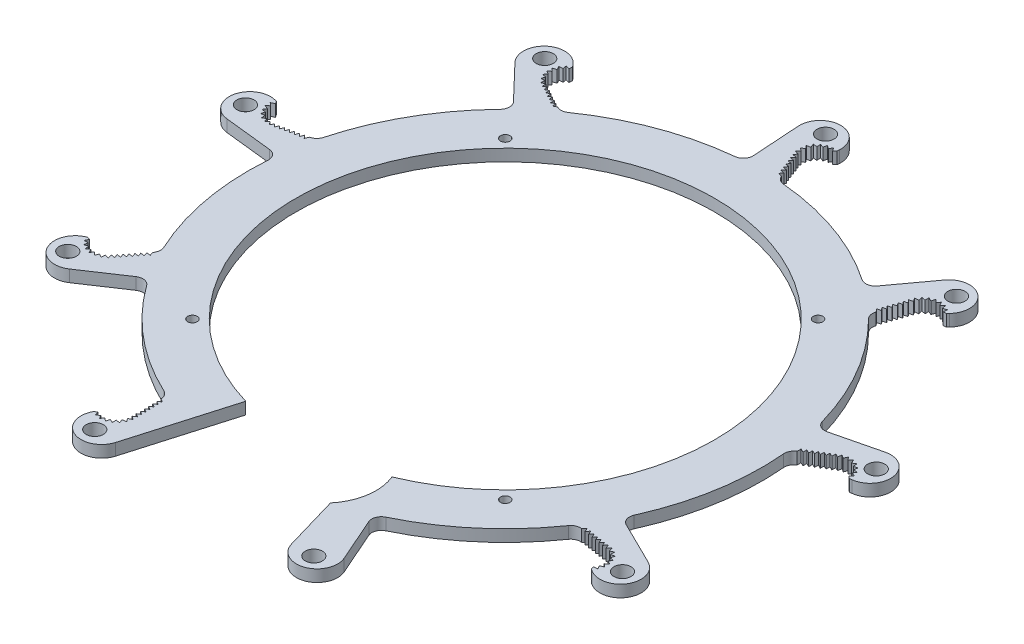
from build123d import *

# Parameters (mm, degrees)
SKETCH1_R           = 68.58
SKETCH1_R_2         = 55.88
BOSS_EXTRUDE1_DEPTH = 3.175
BOSS_EXTRUDE2_START = -3.175
BOSS_EXTRUDE2_DEPTH = 3.175
CIRPATTERN1_COUNT   = 9
SKETCH4_R           = 1.27
CUT_EXTRUDE1_DEPTH  = 126.801087163
CIRPATTERN14_COUNT  = 4
CUT_EXTRUDE4_DEPTH  = 126.801087163
BOSS_EXTRUDE4_START = -3.175
BOSS_EXTRUDE4_DEPTH = 3.175
SKETCH11_R          = 0.0635
CUT_EXTRUDE6_DEPTH  = 126.801087163
CRVPATTERN8_DEPTH   = 3.175
CIRPATTERN15_COUNT  = 9
CUT_EXTRUDE7_DEPTH  = 126.801087163
SKETCH3_R           = 2.286
CUT_EXTRUDE8_DEPTH  = 126.801087163
CIRPATTERN16_COUNT  = 9


# Read off the part's stored shape, not the designer's step: CrvPattern8
with BuildPart() as part:
    # Sketch1 → Boss-Extrude1 (new body)
    with BuildSketch(Plane(origin=(0, 0, 0), x_dir=(1, 0, 0), z_dir=(0, 1, 0))):
        with Locations(Location((0, 0, 0), (0, 0, 270))):
            Circle(SKETCH1_R)
        with Locations(Location((0, 0, 0), (0, 0, 270))):
            Circle(SKETCH1_R_2, mode=Mode.SUBTRACT)
    extrude(amount=BOSS_EXTRUDE1_DEPTH)

    # Sketch2 → Boss-Extrude2 (add)
    with BuildSketch(Plane(origin=(0, 3.175, 0), x_dir=(1, 0, 0), z_dir=(0, 1, 0)).offset(BOSS_EXTRUDE2_START)):
        with BuildLine():
            Line((-4.648503105, 70.922452149), (-5.403257241, 82.437775015))
            Line((-5.403257241, 82.437775015), (-5.486319215, 83.705055847))
            ThreePointArc((-5.486319215, 83.705055847), (0, 89.562739257), (5.486319215, 83.705055847))
            Line((5.486319215, 83.705055847), (5.403257241, 82.437775015))
            ThreePointArc((5.403257241, 82.437775015), (1.626784434, 81.258873226), (0.932471896, 77.364070743))
            Line((0.932471896, 77.364070743), (3.81, 69.933821868))
            ThreePointArc((3.81, 69.933821868), (4.653269667, 68.820093806), (5.957919454, 68.320711324))
            ThreePointArc((5.957919454, 68.320711324), (-0.486454802, 68.578274707), (-6.926526743, 68.22931648))
            ThreePointArc((-6.926526743, 68.22931648), (-5.243785443, 69.115963701), (-4.648503105, 70.922452149))
        make_face()
    boss_extrude2 = extrude(amount=BOSS_EXTRUDE2_DEPTH)

    # CirPattern1: Boss-Extrude2 ×9 about axis
    cirpattern1_axis = Axis((0, 0, 0), (0, 1, 0))
    for i in range(1, CIRPATTERN1_COUNT):
        add(boss_extrude2.rotate(cirpattern1_axis, i * 360 / CIRPATTERN1_COUNT))

    # Sketch4 → Cut-Extrude1 (cut, through all)
    with BuildSketch(Plane(origin=(0, 3.175, 0), x_dir=(1, 0, 0), z_dir=(0, 1, 0))):
        with Locations(Location((41.758190963, 41.758190963, 0), (0, 0, 270))):
            Circle(SKETCH4_R)
    cut_extrude1 = extrude(amount=-CUT_EXTRUDE1_DEPTH, mode=Mode.SUBTRACT)

    # CirPattern14: Cut-Extrude1 ×4 about axis
    cirpattern14_axis = Axis((0, 0, 0), (0, 1, 0))
    for i in range(1, CIRPATTERN14_COUNT):
        add(cut_extrude1.rotate(cirpattern14_axis, i * 360 / CIRPATTERN14_COUNT), mode=Mode.SUBTRACT)

    # Sketch5 → Cut-Extrude4 (cut, through all)
    with BuildSketch(Plane(origin=(0, 3.175, 0), x_dir=(1, 0, 0), z_dir=(0, 1, 0))):
        with BuildLine():
            Line((-19.888743183, -68.235186631), (-15.636845304, -53.647585863))
            ThreePointArc((-15.636845304, -53.647585863), (0, -55.88), (15.636845304, -53.647585863))
            Line((15.636845304, -53.647585863), (19.329786067, -66.317491642))
            ThreePointArc((19.329786067, -66.317491642), (18.5553687, -66.154732632), (17.768446533, -66.238196743))
            ThreePointArc((17.768446533, -66.238196743), (0.486454802, -68.578274707), (-16.826994534, -66.483596887))
            ThreePointArc((-16.826994534, -66.483596887), (-18.711505325, -66.741241317), (-19.888743183, -68.235186631))
        make_face()
    extrude(amount=-CUT_EXTRUDE4_DEPTH, mode=Mode.SUBTRACT)

    # Sketch8 → Boss-Extrude4 (add)
    with BuildSketch(Plane(origin=(0, 3.175, 0), x_dir=(1, 0, 0), z_dir=(0, 1, 0)).offset(BOSS_EXTRUDE4_START)):
        with BuildLine():
            Line((20.338546893, -67.019393099), (25.583833604, -73.017370562))
            ThreePointArc((25.583833604, -73.017370562), (26.263494139, -76.91475659), (23.117978668, -79.314191671))
            Line((23.117978668, -79.314191671), (19.329786067, -66.317491642))
            ThreePointArc((19.329786067, -66.317491642), (19.877256539, -66.606514072), (20.338546893, -67.019393099))
        make_face()
    extrude(amount=BOSS_EXTRUDE4_DEPTH)

    # Sketch11 → Cut-Extrude6 (cut, through all)
    with BuildSketch(Plane(origin=(0, 3.175, 0), x_dir=(1, 0, 0), z_dir=(0, 1, 0))):
        with Locations((4.474572189, 71.558672285)):
            Circle(SKETCH11_R)
        Polygon((3.498451264, 71.089959522), (3.95709435, 69.905667953), (2.780339552, 70.130899269), align=None)
    cut_extrude6 = extrude(amount=-CUT_EXTRUDE6_DEPTH, mode=Mode.SUBTRACT)

    # CrvPattern8 outline → CrvPattern8 (cut)
    with BuildSketch(Plane(origin=(0, 0, 0), x_dir=(1, 0, 0), z_dir=(0, 1, 0))):
        with BuildLine():
            Line((0.965870842, 77.246670917), (0.345476312, 76.418114962))
            Line((0.345476312, 76.418114962), (1.37513676, 76.22103756))
            Line((1.37513676, 76.22103756), (0.932471896, 77.364070743))
            ThreePointArc((0.932471896, 77.364070743), (1.626784434, 81.258873226), (5.403257241, 82.437775015))
            Line((5.403257241, 82.437775015), (5.449136611, 83.137758941))
            Line((5.449136611, 83.137758941), (4.852674168, 82.560680789))
            Line((4.852674168, 82.560680789), (4.242889668, 83.432740738))
            Line((4.242889668, 83.432740738), (3.726224495, 82.50248121))
            Line((3.726224495, 82.50248121), (2.88928111, 83.159635273))
            Line((2.88928111, 83.159635273), (2.665331301, 82.119360225))
            Line((2.665331301, 82.119360225), (1.673506022, 82.504857707))
            Line((1.673506022, 82.504857707), (1.761611498, 81.444403504))
            Line((1.761611498, 81.444403504), (0.700556651, 81.524953505))
            Line((0.700556651, 81.524953505), (1.093108774, 80.535899147))
            Line((1.093108774, 80.535899147), (0.05445523, 80.304545508))
            Line((0.05445523, 80.304545508), (0.717553875, 79.472304029))
            Line((0.717553875, 79.472304029), (-0.209002033, 78.949026052))
            Line((-0.209002033, 78.949026052), (0.667379075, 78.345468395))
            Line((0.667379075, 78.345468395), (-0.067063422, 77.575455466))
            Line((-0.067063422, 77.575455466), (0.965870842, 77.246670917))
        make_face()
        Polygon((3.40418946, 70.98169115), (3.00287676, 72.017946273), (2.374529012, 71.178768551), align=None)
        Polygon((2.99837892, 72.029560432), (2.59706622, 73.065815555), (1.968718472, 72.226637833), align=None)
        Polygon((2.59256838, 73.077429714), (2.19125568, 74.113684837), (1.562907932, 73.274507115), align=None)
        Polygon((2.18675784, 74.125298996), (1.78544514, 75.161554119), (1.157097392, 74.322376397), align=None)
        Polygon((1.7809473, 75.173168278), (1.3796346, 76.209423401), (0.751286852, 75.37024568), align=None)
    crvpattern8 = extrude(amount=CRVPATTERN8_DEPTH, mode=Mode.SUBTRACT)

    # CirPattern15: Cut-Extrude6, CrvPattern8 ×9 about axis, 1 skipped
    cirpattern15_axis = Axis((0, 0, 0), (0, -1, 0))
    add([cut_extrude6.rotate(cirpattern15_axis, i * 360 / CIRPATTERN15_COUNT) for i in range(1, CIRPATTERN15_COUNT) if i not in (4,)], mode=Mode.SUBTRACT)
    add([crvpattern8.rotate(cirpattern15_axis, i * 360 / CIRPATTERN15_COUNT) for i in range(1, CIRPATTERN15_COUNT) if i not in (4,)], mode=Mode.SUBTRACT)

    # Sketch12 → Cut-Extrude7 (cut, through all)
    with BuildSketch(Plane(origin=(0, 3.175, 0), x_dir=(1, 0, 0), z_dir=(0, 1, 0))):
        with BuildLine():
            Line((19.190673782, -65.840219014), (15.636845304, -53.647585863))
            ThreePointArc((15.636845304, -53.647585863), (18.538164393, -52.715375944), (21.384350201, -51.626388277))
            ThreePointArc((21.384350201, -51.626388277), (22.276710535, -59.040304482), (19.190673782, -65.840219014))
        make_face()
    extrude(amount=-CUT_EXTRUDE7_DEPTH, mode=Mode.SUBTRACT)

    # Sketch3 → Cut-Extrude8 (cut, through all)
    with BuildSketch(Plane(origin=(0, 3.175, 0), x_dir=(1, 0, 0), z_dir=(0, 1, 0))):
        with Locations(Location((0, 85.498739257, 0), (0, 0, 270))):
            Circle(SKETCH3_R)
    cut_extrude8 = extrude(amount=-CUT_EXTRUDE8_DEPTH, mode=Mode.SUBTRACT)

    # CirPattern16: Cut-Extrude8 ×9 about axis
    cirpattern16_axis = Axis((0, 0, 0), (0, 1, 0))
    for i in range(1, CIRPATTERN16_COUNT):
        add(cut_extrude8.rotate(cirpattern16_axis, i * 360 / CIRPATTERN16_COUNT), mode=Mode.SUBTRACT)


solid = part.part
